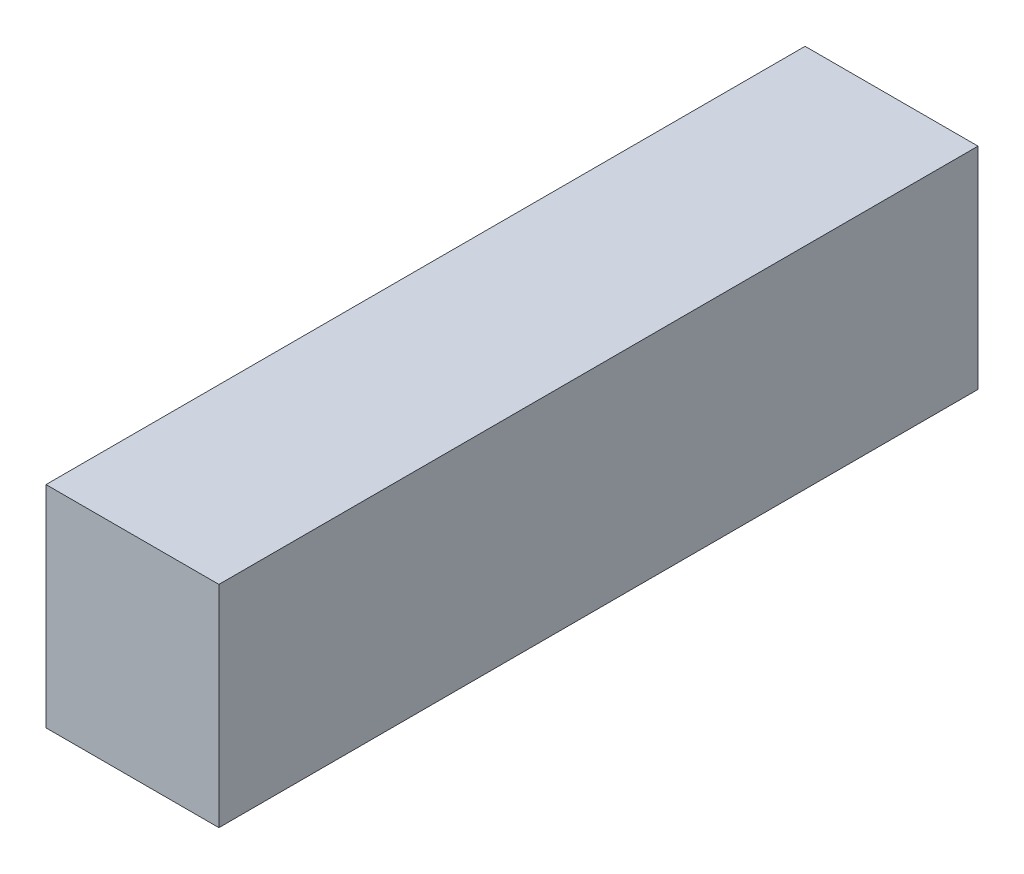
from build123d import *

# Parameters (mm, degrees)
SKETCH1_W           = 131.70814305
SKETCH1_H           = 36.561123322
BOSS_EXTRUDE1_DEPTH = 30


with BuildPart() as part:
    # Sketch1 → Boss-Extrude1 (new body)
    with BuildSketch(Plane(origin=(0, 0, 0), x_dir=(0, 0, -1), z_dir=(1, 0, 0))):
        with Locations((16.959075276, 7.158051253)):
            Rectangle(SKETCH1_W, SKETCH1_H)
    extrude(amount=BOSS_EXTRUDE1_DEPTH)


solid = part.part
